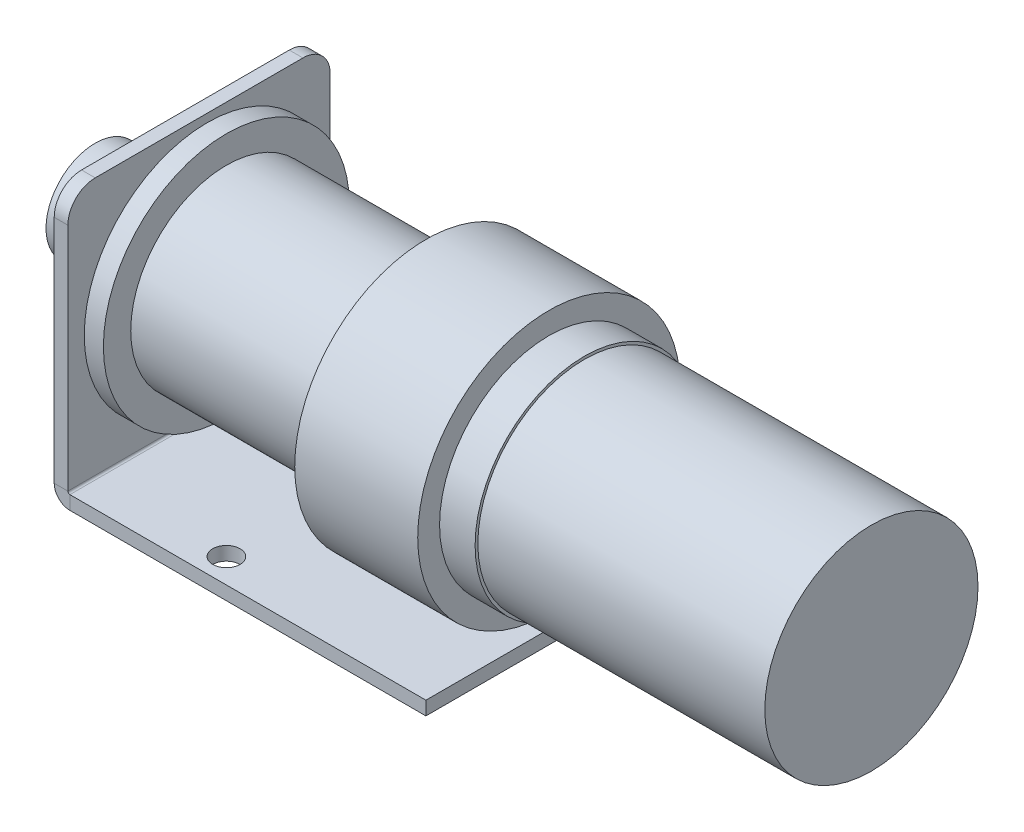
from build123d import *

# Parameters (mm, degrees)
SM_BASE_FLANGE_1_DEPTH = 48
FILLET_1_R             = 10
SKETCH_7_R             = 5
CUT_EXTRUDE_1_DEPTH    = 10


# Sheet-metal steps are written as plain solids
with BuildPart() as part:
    # Sketch 1 → Повернуть1 (revolve)
    with BuildSketch(Plane.XY, mode=Mode.PRIVATE) as revolve_1_sk:
        Polygon((-121, 0), (-121, 18), (-111, 18), (-111, 7.5), (-80, 7.5), (-80, 45), (-73, 45), (-73, 35), (0, 35), (0, 48), (45, 48), (45, 40), (58, 40), (58, 39), (163, 39), (163, 0), align=None)
    revolve(revolve_1_sk.sketch.rotate(Axis((-1759.029233716, 0, 0), (1, 0, 0)), 90), axis=Axis((-1759.029233716, 0, 0), (1, 0, 0)))


with BuildPart() as body_2:
    # Sketch 2 → Базовая кромка1 (new, symmetric)
    with BuildSketch(Plane.XY):
        with BuildLine():
            Line((-83, 45), (-83, -49.26))
            ThreePointArc((-83, -49.26), (-82.783259018, -49.783259018), (-82.26, -50))
            Line((-82.26, -50), (48, -50))
            Line((48, -50), (48, -55))
            Line((48, -55), (-82.26, -55))
            ThreePointArc((-82.26, -55), (-86.318792924, -53.318792924), (-88, -49.26))
            Line((-88, -49.26), (-88, 45))
            Line((-88, 45), (-83, 45))
        make_face()
    extrude(amount=SM_BASE_FLANGE_1_DEPTH, both=True)

    # Скругление1
    fillet_1_edges = [body_2.edges().sort_by_distance(p)[0] for p in [
        (-85.5, 45, 48),
        (-85.5, 45, -48),
    ]]
    fillet(fillet_1_edges, radius=FILLET_1_R)

    # Эскиз7 → Вырез-Вытянуть1 (cut)
    with BuildSketch(Plane.XZ.offset(55)):
        with Locations(Location((-34, 39, 0), (0, 0, 270))):
            Circle(SKETCH_7_R)
        with Locations(Location((-34, -39, 0), (0, 0, 270))):
            Circle(SKETCH_7_R)
    extrude(amount=-CUT_EXTRUDE_1_DEPTH, mode=Mode.SUBTRACT)


solid = Compound([part.part, body_2.part])
